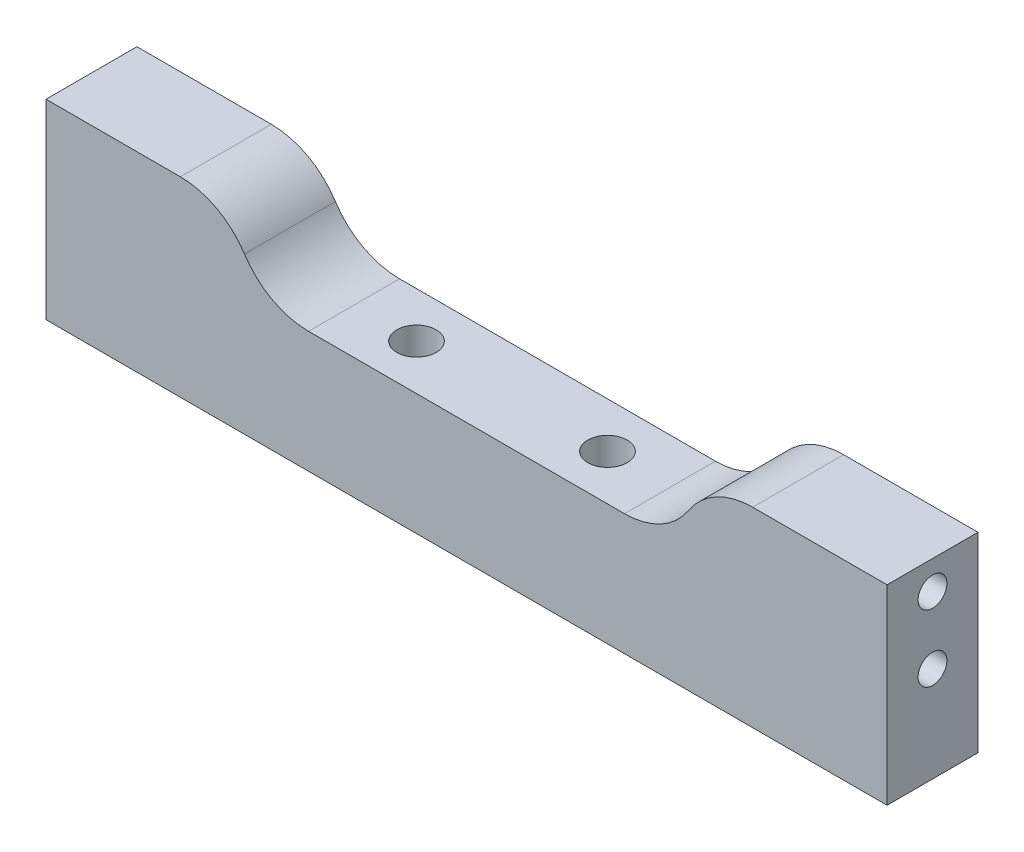
from build123d import *

# Parameters (mm, degrees)
SKETCH1_W                 = 44.04
SKETCH1_H                 = 10
BOSS_EXTRUDE1_DEPTH       = 4.7625
SKETCH2_R                 = 1.03
CUT_EXTRUDE1_DEPTH        = 25.648768859
F_1_64_TAPPED_HOLE1_D     = 1.5113
F_1_64_TAPPED_HOLE1_DEPTH = 6.35
F_1_64_TAPPED_HOLE1_TIP   = 0.454040327
F_1_64_TAPPED_HOLE2_D     = 1.5113
F_1_64_TAPPED_HOLE2_DEPTH = 6.35
F_1_64_TAPPED_HOLE2_TIP   = 0.454040327
SKETCH7_W                 = 22
SKETCH7_H                 = 3.65
CUT_EXTRUDE2_DEPTH        = 10
FILLET1_R                 = 4
FILLET2_R                 = 4


with BuildPart() as part:
    # Sketch1 → Boss-Extrude1 (new body)
    with BuildSketch(Plane.XY):
        Rectangle(SKETCH1_W, SKETCH1_H)
    extrude(amount=BOSS_EXTRUDE1_DEPTH)

    # Sketch2 → Cut-Extrude1 (cut, through all)
    with BuildSketch(Plane(origin=(0, 5, 0), x_dir=(1, 0, 0), z_dir=(0, 1, 0))):
        with Locations(Location((-5, -2.38125, 0), (0, 0, 270))):
            Circle(SKETCH2_R)
        with Locations(Location((5, -2.38125, 0), (0, 0, 270))):
            Circle(SKETCH2_R)
    extrude(amount=-CUT_EXTRUDE1_DEPTH, mode=Mode.SUBTRACT)

    # #1-64 Tapped Hole1
    with Locations(Plane.ZY.offset(22.02)):
        with Locations((2.38125, 3.5), (2.38125, 0)):
            Hole(F_1_64_TAPPED_HOLE1_D / 2, depth=F_1_64_TAPPED_HOLE1_DEPTH)
            with Locations((0, 0, -(F_1_64_TAPPED_HOLE1_DEPTH + F_1_64_TAPPED_HOLE1_TIP / 2))):  # 118° drill point
                Cone(0, F_1_64_TAPPED_HOLE1_D / 2, F_1_64_TAPPED_HOLE1_TIP, mode=Mode.SUBTRACT)

    # #1-64 Tapped Hole2
    with Locations(Plane(origin=(22.02, 0, 0), x_dir=(0, 0, -1), z_dir=(1, 0, 0))):
        with Locations((-2.38125, 3.5), (-2.38125, 0)):
            Hole(F_1_64_TAPPED_HOLE2_D / 2, depth=F_1_64_TAPPED_HOLE2_DEPTH)
            with Locations((0, 0, -(F_1_64_TAPPED_HOLE2_DEPTH + F_1_64_TAPPED_HOLE2_TIP / 2))):  # 118° drill point
                Cone(0, F_1_64_TAPPED_HOLE2_D / 2, F_1_64_TAPPED_HOLE2_TIP, mode=Mode.SUBTRACT)

    # Sketch7 → Cut-Extrude2 (cut)
    with BuildSketch(Plane.XY.offset(4.7625)):
        with Locations((0, 3.175)):
            Rectangle(SKETCH7_W, SKETCH7_H)
    extrude(amount=-CUT_EXTRUDE2_DEPTH, mode=Mode.SUBTRACT)

    # Fillet1
    # the kernel refuses this fillet: 4 mm, written as the material it takes off along each edge
    with BuildSketch(Plane(origin=(11, 5, 14.724145195), x_dir=(0, -1, 0), z_dir=(0, 0, -1))) as fillet1_piece_1:
        with BuildLine():
            CenterArc((4, -3.984658078), FILLET1_R, 95.019800132, 84.980199868)
            Line((0, -3.984658078), (-0.08, -3.984658078))
            Line((-0.08, -3.984658078), (-0.08, 0))
            Line((-0.08, 0), (0, 0.08))
            ThreePointArc((0, 0.08), (1.825, 0.08), (3.643, 0.079693162))
            Line((3.643, 0.079693162), (3.65, 0))
        make_face()
    extrude(amount=24.685790391, mode=Mode.SUBTRACT)
    with BuildSketch(Plane(origin=(-11, 5, 14.724145195), x_dir=(-1, 0, 0), z_dir=(0, 0, -1))) as fillet1_piece_2:
        with BuildLine():
            CenterArc((3.984658078, -4), FILLET1_R, 90, 84.980199868)
            Line((0, -3.65), (-0.079693162, -3.643))
            ThreePointArc((-0.079693162, -3.643), (-0.08, -1.825), (-0.08, 0))
            Line((-0.08, 0), (0, 0.08))
            Line((0, 0.08), (3.984658078, 0.08))
            Line((3.984658078, 0.08), (3.984658078, 0))
        make_face()
    extrude(amount=24.685790391, mode=Mode.SUBTRACT)

    # Fillet2
    fillet2_edges = [part.edges().sort_by_distance(p)[0] for p in [
        (11, 1.35, 2.38125),
        (-11, 1.35, 2.38125),
    ]]
    fillet(fillet2_edges, radius=FILLET2_R)


solid = part.part
